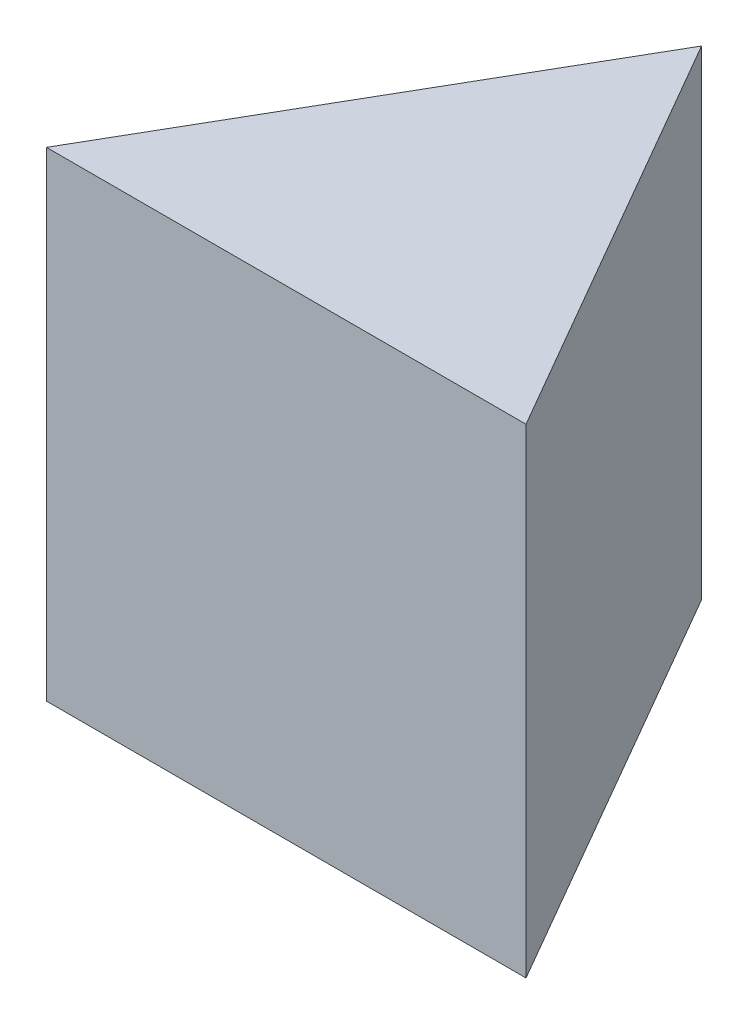
from build123d import *

# Parameters (mm, degrees)
BOSS_EXTRUDE1_DEPTH = 10


with BuildPart() as part:
    # Sketch1 → Boss-Extrude1 (new body)
    with BuildSketch(Plane(origin=(0, 0, 0), x_dir=(1, 0, 0), z_dir=(0, 1, 0))):
        Polygon((-5, 7.877645342), (-10, -0.782608696), (0, -0.782608696), align=None)
    extrude(amount=BOSS_EXTRUDE1_DEPTH)


solid = part.part
